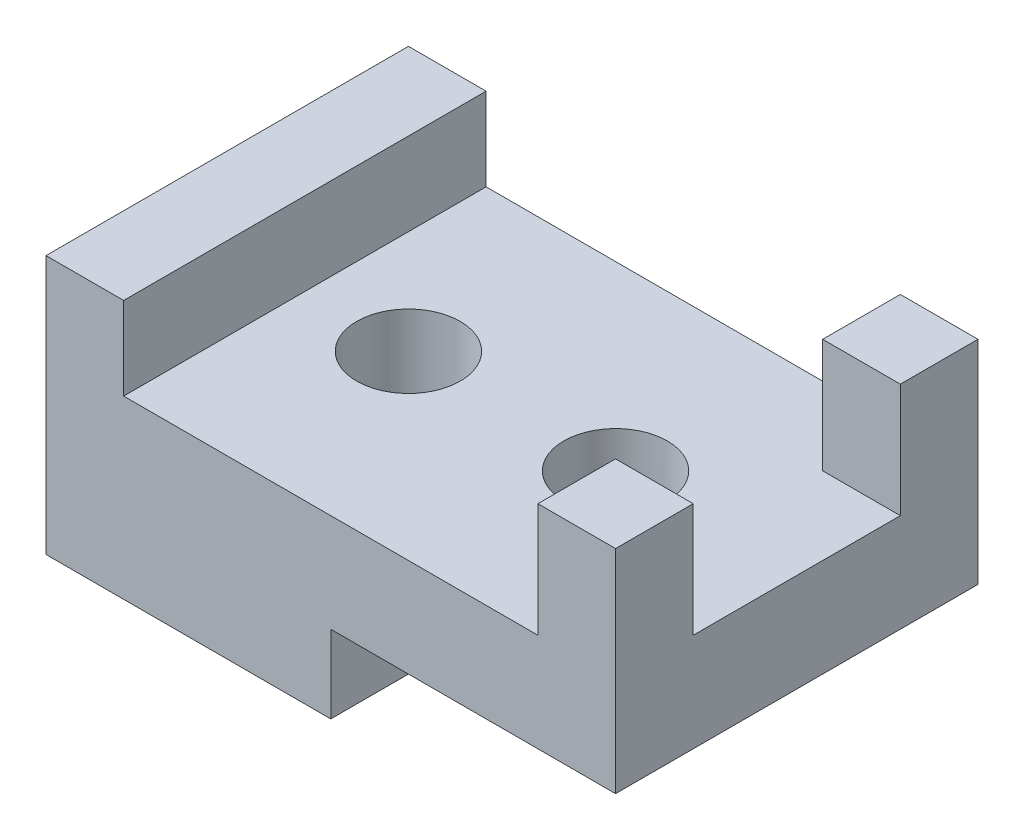
from build123d import *

# Parameters (mm, degrees)
RESSALTO_EXTRUS_O1_DEPTH = 70
ESBO_O2_W                = 15
ESBO_O2_H                = 15
RESSALTO_EXTRUS_O2_DEPTH = 22
ESBO_O3_R                = 10
CORTE_EXTRUS_O1_DEPTH    = 10
ESBO_O3_4_R              = 10
CORTE_EXTRUS_O2_DEPTH    = 20


with BuildPart() as part:
    # Esboço1 → Ressalto-extrusão1 (new body)
    with BuildSketch(Plane.XY):
        Polygon((0, 0), (0, -50), (55, -50), (55, -35), (110, -35), (110, -16), (15, -16), (15, 0), align=None)
    extrude(amount=RESSALTO_EXTRUS_O1_DEPTH)

    # Esboço2 → Ressalto-extrusão2 (add)
    with BuildSketch(Plane(origin=(0, -16, 0), x_dir=(1, 0, 0), z_dir=(0, 1, 0))):
        with Locations((102.5, -62.5)):
            Rectangle(ESBO_O2_W, ESBO_O2_H)
        with Locations((102.5, -7.5)):
            Rectangle(ESBO_O2_W, ESBO_O2_H)
    extrude(amount=RESSALTO_EXTRUS_O2_DEPTH)

    # Esboço3 → Corte-extrusão1 (cut)
    with BuildSketch(Plane(origin=(0, -16, 0), x_dir=(1, 0, 0), z_dir=(0, 1, 0))):
        with Locations((35, -35)):
            Circle(ESBO_O3_R)
    extrude(amount=-CORTE_EXTRUS_O1_DEPTH, mode=Mode.SUBTRACT)

    # Esboço3<4> → Corte-extrusão2 (cut)
    with BuildSketch(Plane(origin=(0, -16, 0), x_dir=(1, 0, 0), z_dir=(0, 1, 0))):
        with Locations((35, -35)):
            Circle(ESBO_O3_4_R)
        with Locations((75, -35)):
            Circle(ESBO_O3_4_R)
    extrude(amount=-CORTE_EXTRUS_O2_DEPTH, mode=Mode.SUBTRACT)


solid = part.part
